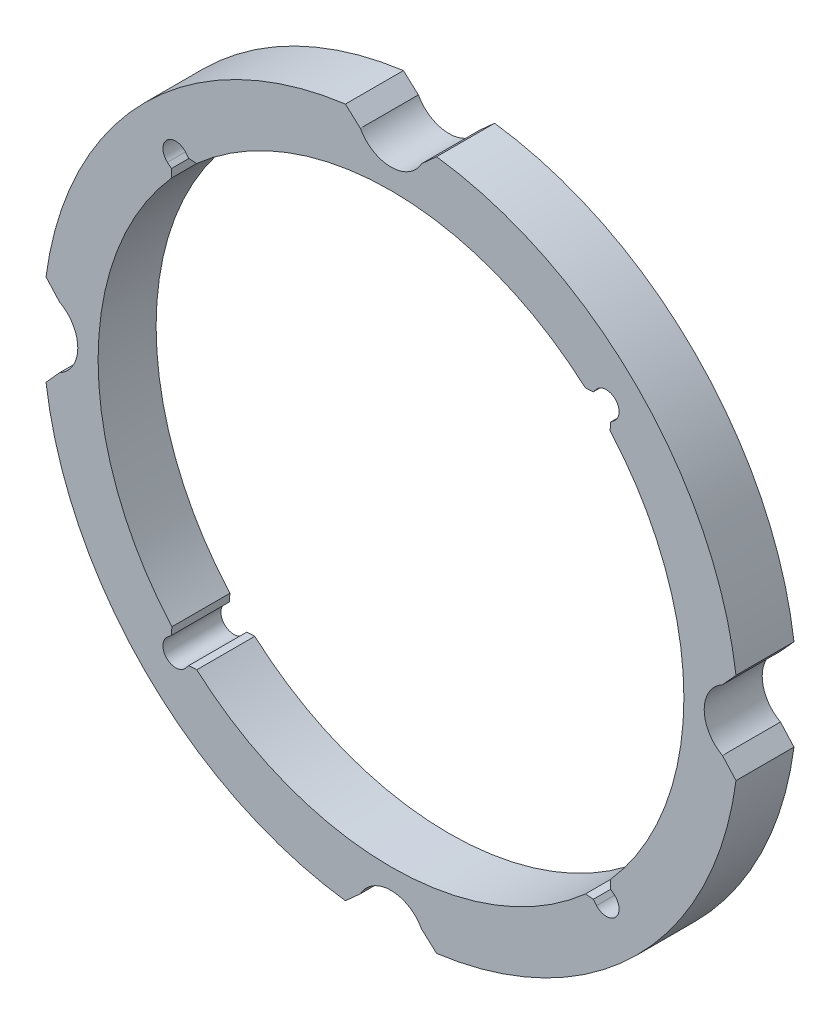
from build123d import *

# Parameters (mm, degrees)
SKETCH_1_R          = 60
EXTRUDE_1_DEPTH     = 10
CHAMFER_1_SIZE      = 0.961662122
CHAMFER_1_SIZE_2    = 1
SKETCH_2_R          = 6
CUT_EXTRUDE_1_DEPTH = 10


with BuildPart() as part:
    # 草图1 → 凸台-拉伸1 (new body)
    with BuildSketch(Plane.XY):
        Circle(SKETCH_1_R)
        with BuildLine():
            Line((-38.547540209, 35.446506114), (-37.123106012, 34.236311133))
            ThreePointArc((-37.123106012, 34.236311133), (-50.5, 0), (-37.123106012, -34.236311133))
            Line((-37.123106012, -34.236311133), (-38.547540209, -35.446506114))
            ThreePointArc((-38.547540209, -35.446506114), (-38.678740931, -38.678740931), (-35.446506114, -38.547540209))
            Line((-35.446506114, -38.547540209), (-34.236311133, -37.123106012))
            ThreePointArc((-34.236311133, -37.123106012), (0, -50.5), (34.236311133, -37.123106012))
            Line((34.236311133, -37.123106012), (35.446506114, -38.547540209))
            ThreePointArc((35.446506114, -38.547540209), (38.678740931, -38.678740931), (38.547540209, -35.446506114))
            Line((38.547540209, -35.446506114), (37.123106012, -34.236311133))
            ThreePointArc((37.123106012, -34.236311133), (50.5, 0), (37.123106012, 34.236311133))
            Line((37.123106012, 34.236311133), (38.547540209, 35.446506114))
            ThreePointArc((38.547540209, 35.446506114), (38.678740931, 38.678740931), (35.446506114, 38.547540209))
            Line((35.446506114, 38.547540209), (34.236311133, 37.123106012))
            ThreePointArc((34.236311133, 37.123106012), (0, 50.5), (-34.236311133, 37.123106012))
            Line((-34.236311133, 37.123106012), (-35.446506114, 38.547540209))
            ThreePointArc((-35.446506114, 38.547540209), (-38.678740931, 38.678740931), (-38.547540209, 35.446506114))
        make_face(mode=Mode.SUBTRACT)
    extrude(amount=EXTRUDE_1_DEPTH)

    # 倒角1
    # the kernel refuses this chamfer: 1, 0.961662122 mm, written as the material it takes off along each edge
    with BuildSketch(Plane(origin=(34.236311133, 37.123106012, -2.597741643), x_dir=(-0.7418547410377812, 0.6705606185869901, 0), z_dir=(0, 0, 1)), Plane(origin=(-37.123106012, 34.236311133, -2.597741643), x_dir=(-0.6705606185869967, -0.741854741037775, 0), z_dir=(0, 0, 1)), Plane(origin=(-34.236311133, -37.123106012, -2.597741643), x_dir=(0.7418547410378011, -0.670560618586968, 0), z_dir=(0, 0, 1)), Plane(origin=(37.123106012, -34.236311133, -2.597741643), x_dir=(0.6705606185869861, 0.7418547410377846, 0), z_dir=(0, 0, 1))) as chamfer_1_piece_1:
        with BuildLine():
            Line((1.010153596, 0), (CHAMFER_1_SIZE * 0.0306993646522, -CHAMFER_1_SIZE * 0.999528663409))
            Line((CHAMFER_1_SIZE * 0.0306993646522, -CHAMFER_1_SIZE * 0.999528663409), (0, 0))
            ThreePointArc((0, 0), (0.519364344, -0.00252381), (1.010153596, 0))
        make_face()
    extrude(amount=15.195483286, mode=Mode.SUBTRACT)
    with BuildSketch(Plane(origin=(-34.236311133, 37.123106012, -2.571682988), x_dir=(-0.6474700896278034, 0.7620908627174087, 0), z_dir=(0, 0, 1)), Plane(origin=(-37.123106012, -34.236311133, -2.571682988), x_dir=(-0.7620908627174083, -0.6474700896278041, 0), z_dir=(0, 0, 1)), Plane(origin=(34.236311133, -37.123106012, -2.571682988), x_dir=(0.6474700896277805, -0.7620908627174282, 0), z_dir=(0, 0, 1)), Plane(origin=(37.123106012, 34.236311133, -2.571682988), x_dir=(0.7620908627174152, 0.6474700896277957, 0), z_dir=(0, 0, 1))) as chamfer_1_piece_2:
        with BuildLine():
            Line((CHAMFER_1_SIZE_2, 0), (0.030170276, -0.969829724))
            ThreePointArc((0.030170276, -0.969829724), (0.017838593, -0.498535983), (0, 0))
            Line((0, 0), (CHAMFER_1_SIZE_2, 0))
        make_face()
    extrude(amount=15.143365976, mode=Mode.SUBTRACT)

    # 草图2 → 切除-拉伸1 (cut)
    with BuildSketch(Plane(origin=(0, 0, 0), x_dir=(-1, 0, 0), z_dir=(0, 0, -1))):
        with Locations((60, 0)):
            Circle(SKETCH_2_R)
        with Locations((-60, 0)):
            Circle(SKETCH_2_R)
        with Locations((0, -60)):
            Circle(SKETCH_2_R)
        with Locations((0, 60)):
            Circle(SKETCH_2_R)
    extrude(amount=-CUT_EXTRUDE_1_DEPTH, mode=Mode.SUBTRACT)

    # 倒角2
    # the kernel refuses this chamfer: 2, 1.907033604 mm, written as the material it takes off along each edge
    with BuildSketch(Plane(origin=(-5.992495307, 59.7, 16.798280923), x_dir=(-0.9933125969799259, -0.11545598590369961, 0), z_dir=(0, 0, -1)), Plane(origin=(59.7, 5.992495307, 16.798280923), x_dir=(-0.11545598590369978, 0.9933125969799259, 0), z_dir=(0, 0, -1)), Plane(origin=(5.992495307, -59.7, 16.798280923), x_dir=(0.993312596979926, 0.11545598590369918, 0), z_dir=(0, 0, -1)), Plane(origin=(-59.7, -5.992495307, 16.798280923), x_dir=(0.11545598590370064, -0.9933125969799258, 0), z_dir=(0, 0, -1))) as chamfer_2_piece_1:
        with BuildLine():
            Line((1.880602566, 0), (-0.414776487, -2.618663345))
            ThreePointArc((-0.414776487, -2.618663345), (-0.066481971, -1.366902402), (0, 0))
            ThreePointArc((0, 0), (0.966657818, 0.007362718), (1.880602566, 0))
        make_face()
    extrude(amount=23.596561846, mode=Mode.SUBTRACT)
    with BuildSketch(Plane(origin=(5.992495307, 59.7, 16.798280923), x_dir=(0.9933125969799259, -0.11545598590369989, 0), z_dir=(0, 0, -1))) as chamfer_2_piece_2:
        with BuildLine():
            Line((1.880602566, 0), (-0.414776487, 2.618663345))
            ThreePointArc((-0.414776487, 2.618663345), (-0.066481971, 1.366902402), (0, 0))
            ThreePointArc((0, 0), (0.966657818, -0.007362718), (1.880602566, 0))
        make_face()
    extrude(amount=23.596561846, mode=Mode.SUBTRACT)
    with BuildSketch(Plane(origin=(-5.992495307, -59.7, 16.798280923), x_dir=(0.26943037499341854, 0.9630198715659537, 0), z_dir=(0, 0, -1)), Plane(origin=(59.7, -5.992495307, 16.798280923), x_dir=(-0.963019871565954, 0.26943037499341704, 0), z_dir=(0, 0, -1)), Plane(origin=(-59.7, 5.992495307, 16.798280923), x_dir=(0.9630198715659543, -0.26943037499341643, 0), z_dir=(0, 0, -1))) as chamfer_2_piece_3:
        with BuildLine():
            Line((2.651308592, 0), (-0.294205559, -1.857446931))
            ThreePointArc((-0.294205559, -1.857446931), (-0.158498115, -0.953603635), (0, 0))
            ThreePointArc((0, 0), (1.360472479, -0.148177801), (2.651308592, 0))
        make_face()
    extrude(amount=23.596561846, mode=Mode.SUBTRACT)


solid = part.part
